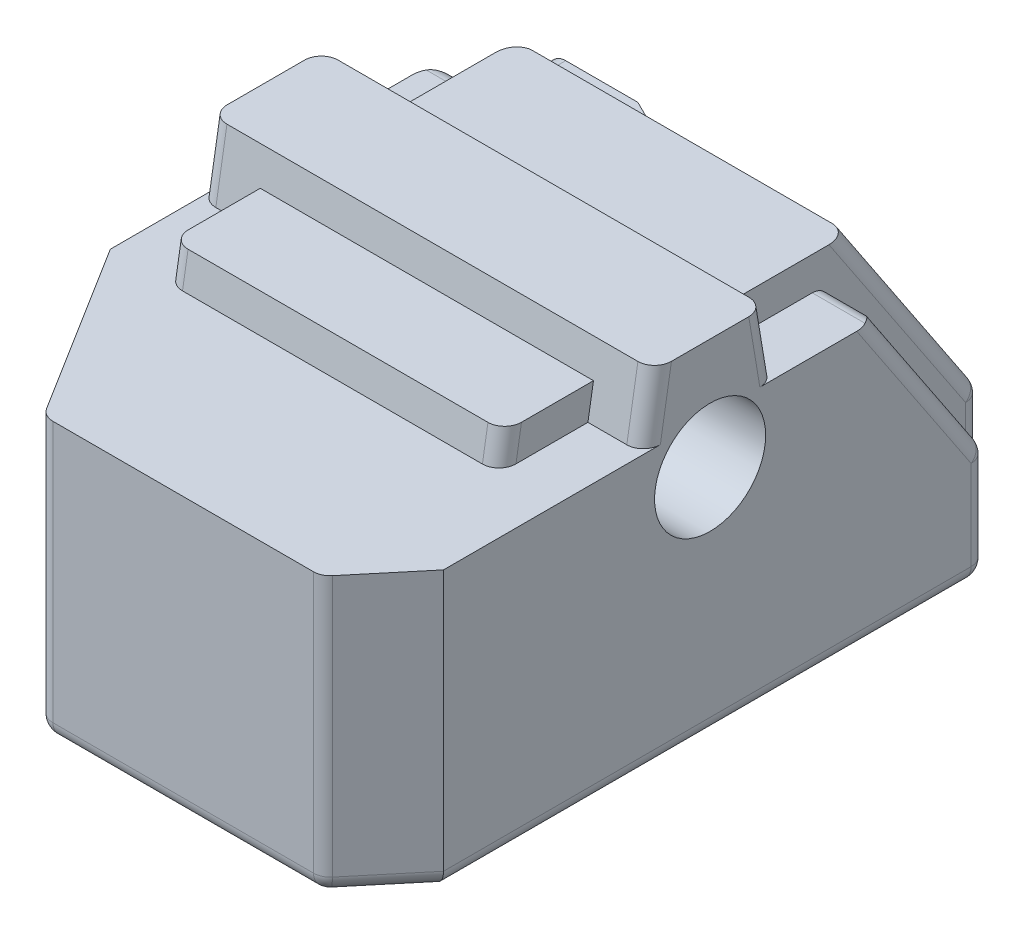
from build123d import *

# Parameters (mm, degrees)
SKETCH1_R           = 5
BOSS_EXTRUDE1_DEPTH = 20
BOSS_EXTRUDE2_DEPTH = 15
CUT_EXTRUDE2_DEPTH  = 49.928519291
BOSS_EXTRUDE3_START = -20
SKETCH4_W           = 20
SKETCH4_H           = 10
BOSS_EXTRUDE3_DEPTH = 20
CUT_EXTRUDE3_DEPTH  = 5
SKETCH2_R           = 10
CUT_EXTRUDE1_DEPTH  = 10
FILLET1_R           = 1.5


with BuildPart() as part:
    # Sketch1 → Boss-Extrude1 (new, symmetric)
    with BuildSketch(Plane(origin=(0, 0, 0), x_dir=(0, 0, -1), z_dir=(1, 0, 0))):
        Polygon((13.5, 12.5), (22.5, 12.5), (32.5, -2.5), (32.5, -12.5), (-22.5, -12.5), (-22.5, 12.5), (1.5, 12.5), (2.5, 18.5), (12.5, 18.5), align=None)
        with Locations((7.5, 8.5)):
            Circle(SKETCH1_R, mode=Mode.SUBTRACT)
    extrude(amount=BOSS_EXTRUDE1_DEPTH, both=True)

    # Sketch1<3> → Boss-Extrude2 (add, symmetric)
    with BuildSketch(Plane(origin=(0, 0, 0), x_dir=(0, 0, -1), z_dir=(1, 0, 0))):
        Polygon((13.5, 12.5), (22.5, 12.5), (32.5, -2.5), (32.5, -11.5), (37, -11.5), (37, -2.5), (25, 15.5), (13, 15.5), align=None)
        Polygon((1.5, 12.5), (2, 15.5), (-6, 15.5), (-6.5, 12.5), align=None)
    extrude(amount=BOSS_EXTRUDE2_DEPTH, both=True)

    # Sketch3 → Cut-Extrude2 (cut, through all)
    with BuildSketch(Plane(origin=(0, 12.5, 0), x_dir=(1, 0, 0), z_dir=(0, 1, 0))):
        Polygon((15, -22.5), (20, -16.5), (20, -22.5), align=None)
        Polygon((-10, -22.5), (-20, -22.5), (-20, -6.5), align=None)
    extrude(amount=-CUT_EXTRUDE2_DEPTH, mode=Mode.SUBTRACT)

    # Sketch4 → Boss-Extrude3 (add)
    with BuildSketch(Plane.XY.offset(BOSS_EXTRUDE3_START)):
        with Locations((-17, -3.8)):
            Rectangle(SKETCH4_W, SKETCH4_H)
    extrude(amount=-BOSS_EXTRUDE3_DEPTH)

    # Sketch5 → Cut-Extrude3 (cut, symmetric)
    with BuildSketch(Plane(origin=(0, -3.8, 0), x_dir=(-1, 0, 0), z_dir=(0, -1, 0))):
        Polygon((7, 40), (19, 40), (7, 34), align=None)
    extrude(amount=CUT_EXTRUDE3_DEPTH, both=True, mode=Mode.SUBTRACT)

    # Sketch2 → Cut-Extrude1 (cut)
    with BuildSketch(Plane.XZ.offset(12.5)):
        with Locations(Location((0, -7.5, 0), (0, 0, 270))):
            Circle(SKETCH2_R)
    extrude(amount=-CUT_EXTRUDE1_DEPTH, mode=Mode.SUBTRACT)

    # Fillet1
    # the kernel refuses this fillet: 1.5 mm, written as the material it takes off along each edge
    with BuildSketch(Plane(origin=(-9.168628538, -11, 21), x_dir=(0, 0, 1), z_dir=(0, -1, 0))) as fillet1_piece_1_section:
        Polygon((0, 0), (FILLET1_R, 0), (FILLET1_R, FILLET1_R * 0.554247641507), (FILLET1_R * 0.529998940003, FILLET1_R * 0.847998304005), align=None)
    fillet1_piece_1 = extrude(amount=FILLET1_R, mode=Mode.PRIVATE)
    fillet1_piece_1 = fillet1_piece_1 - Plane(origin=(-9.168628538, -11, 21), x_dir=(0.4847685323929452, 0, -0.8746424812468178), z_dir=(0, -1, 0)) * Sphere(FILLET1_R, mode=Mode.PRIVATE)
    add(fillet1_piece_1, mode=Mode.SUBTRACT)
    with BuildSketch(Plane(origin=(18.5, -2.954163457, -31), x_dir=(0, 0, -1), z_dir=(1, 0, 0))) as fillet1_piece_2_section:
        Polygon((0, 0), (FILLET1_R, 0), (FILLET1_R, FILLET1_R * 0.302775637732), (FILLET1_R * 0.832050294338, FILLET1_R * 0.554700196225), align=None)
    fillet1_piece_2 = extrude(amount=FILLET1_R, mode=Mode.PRIVATE)
    fillet1_piece_2 = fillet1_piece_2 - Plane(origin=(18.5, -2.954163457, -31), x_dir=(0, -0.2897841486884299, 0.9570920264890529), z_dir=(1, 0, 0)) * Sphere(FILLET1_R, mode=Mode.PRIVATE)
    add(fillet1_piece_2, mode=Mode.SUBTRACT)
    with BuildSketch(Plane(origin=(18.5, -11, -31), x_dir=(1, 0, 0), z_dir=(0, 0, -1))) as fillet1_piece_3_section:
        Polygon((0, 0), (FILLET1_R, 0), (FILLET1_R, FILLET1_R), (0, FILLET1_R), align=None)
    fillet1_piece_3 = extrude(amount=FILLET1_R, mode=Mode.PRIVATE)
    fillet1_piece_3 = fillet1_piece_3 - Plane(origin=(18.5, -11, -31), x_dir=(-0.7071067811865475, 0.7071067811865475, 0), z_dir=(0, 0, -1)) * Sphere(FILLET1_R, mode=Mode.PRIVATE)
    add(fillet1_piece_3, mode=Mode.SUBTRACT)
    with BuildSketch(Plane(origin=(13.5, -2.954163457, -35.5), x_dir=(0, 0.5547001962252297, -0.8320502943378434), z_dir=(1, 0, 0))) as fillet1_piece_4_section:
        Polygon((0, 0), (FILLET1_R, 0), (FILLET1_R, -FILLET1_R * 0.302775637732), (FILLET1_R * 0.832050294338, -FILLET1_R * 0.554700196225), align=None)
    fillet1_piece_4 = extrude(amount=FILLET1_R, mode=Mode.PRIVATE)
    fillet1_piece_4 = fillet1_piece_4 - Plane(origin=(13.5, -2.954163457, -35.5), x_dir=(0, -0.2897841486884304, 0.9570920264890528), z_dir=(1, 0, 0)) * Sphere(FILLET1_R, mode=Mode.PRIVATE)
    add(fillet1_piece_4, mode=Mode.SUBTRACT)
    with BuildSketch(Plane(origin=(14.297437581, -11, 21), x_dir=(0, 0, 1), z_dir=(0, -1, 0))) as fillet1_piece_5_section:
        Polygon((0, 0), (FILLET1_R, 0), (FILLET1_R, -FILLET1_R * 0.468374945984), (FILLET1_R * 0.640184399664, -FILLET1_R * 0.768221279597), align=None)
    fillet1_piece_5 = extrude(amount=FILLET1_R, mode=Mode.PRIVATE)
    fillet1_piece_5 = fillet1_piece_5 - Plane(origin=(14.297437581, -11, 21), x_dir=(-0.42415539624972376, 0, -0.90558942122368), z_dir=(0, -1, 0)) * Sphere(FILLET1_R, mode=Mode.PRIVATE)
    add(fillet1_piece_5, mode=Mode.SUBTRACT)
    with BuildSketch(Plane(origin=(-10, 14.578428656, 22.5), x_dir=(-0.5299989400031788, 0, -0.8479983040050887), z_dir=(0, -1, 0))) as fillet1_piece_6:
        with BuildLine():
            CenterArc((FILLET1_R * 0.554247641507, FILLET1_R), FILLET1_R, 212.005383208, 57.994616792)
            Line((-FILLET1_R * 0.293750662498, FILLET1_R * 0.470001059997), (0, 0))
            Line((0, 0), (FILLET1_R * 0.554247641507, 0))
        make_face()
    extrude(amount=25.578428656, mode=Mode.SUBTRACT)
    with BuildSketch(Plane(origin=(20, -2.954163457, -32.5), x_dir=(0, 0, 1), z_dir=(0, -1, 0))) as fillet1_piece_7:
        with BuildLine():
            CenterArc((FILLET1_R, FILLET1_R), FILLET1_R, 180, 90)
            Line((0, FILLET1_R), (0, 0))
            Line((0, 0), (FILLET1_R, 0))
        make_face()
    extrude(amount=8.045836543, mode=Mode.SUBTRACT)
    with BuildSketch(Plane(origin=(15, -15.25, -37), x_dir=(0, 0, 1), z_dir=(0, 1, 0))) as fillet1_piece_8:
        with BuildLine():
            CenterArc((FILLET1_R, -FILLET1_R), FILLET1_R, 90, 90)
            Line((0, -FILLET1_R), (0, 0))
            Line((0, 0), (FILLET1_R, 0))
        make_face()
    extrude(amount=12.295836543, mode=Mode.SUBTRACT)
    with BuildSketch(Plane(origin=(13.5, -2.5, -37), x_dir=(0, 0.8320502943378404, 0.5547001962252341), z_dir=(-1, 0, 0))) as fillet1_piece_9:
        with BuildLine():
            CenterArc((FILLET1_R * 0.302775637732, -FILLET1_R), FILLET1_R, 90, 33.690067526)
            Line((-FILLET1_R * 0.251924558493, -FILLET1_R * 0.167949705662), (0, 0))
            Line((0, 0), (FILLET1_R * 0.302775637732, 0))
        make_face()
    extrude(amount=21.635408641, mode=Mode.SUBTRACT)
    with BuildSketch(Plane(origin=(-15, -1.920188604, -36.613459069), x_dir=(0, -0.5547001962252296, 0.8320502943378434), z_dir=(0, 0.8320502943378434, 0.5547001962252297))) as fillet1_piece_10_section:
        with BuildLine():
            CenterArc((FILLET1_R, FILLET1_R), FILLET1_R, 180, 90)
            Line((0, FILLET1_R), (0, 0))
            Line((0, 0), (FILLET1_R, 0))
        make_face()
    fillet1_piece_10 = extrude(amount=24.68646108, mode=Mode.PRIVATE)
    fillet1_piece_10 = split(fillet1_piece_10, bisect_by=Plane(origin=(-14.658418679, 1.2, -28.384678204), z_dir=(0, 1, 0)), keep=Keep.TOP, mode=Mode.PRIVATE)
    add(fillet1_piece_10, mode=Mode.SUBTRACT)
    with BuildSketch(Plane(origin=(15, -2.122113162, -36.748075442), x_dir=(0, -0.5547001962252296, 0.8320502943378433), z_dir=(0, 0.8320502943378434, 0.5547001962252297))) as fillet1_piece_11:
        with BuildLine():
            CenterArc((FILLET1_R, -FILLET1_R), FILLET1_R, 90, 90)
            Line((0, -FILLET1_R), (0, 0))
            Line((0, 0), (FILLET1_R, 0))
        make_face()
    extrude(amount=24.929144196, mode=Mode.SUBTRACT)
    with BuildSketch(Plane(origin=(20, 15.620188604, -20.419874264), x_dir=(0, -0.5547001962252294, 0.8320502943378434), z_dir=(0, -0.8320502943378436, -0.5547001962252295))) as fillet1_piece_12:
        with BuildLine():
            CenterArc((FILLET1_R, FILLET1_R), FILLET1_R, 180, 90)
            Line((0, FILLET1_R), (0, 0))
            Line((0, 0), (FILLET1_R, 0))
        make_face()
    extrude(amount=21.323592921, mode=Mode.SUBTRACT)
    with BuildSketch(Plane(origin=(-20, 15.620188604, -20.419874264), x_dir=(1, 0, 0), z_dir=(0, -0.8320502943378436, -0.5547001962252295))) as fillet1_piece_13_section:
        with BuildLine():
            CenterArc((FILLET1_R, FILLET1_R), FILLET1_R, 180, 90)
            Line((0, FILLET1_R), (0, 0))
            Line((0, 0), (FILLET1_R, 0))
        make_face()
    fillet1_piece_13 = extrude(amount=21.080909804, mode=Mode.PRIVATE)
    fillet1_piece_13 = split(fillet1_piece_13, bisect_by=Plane(origin=(-19.657999481, 1.2, -24.885399818), z_dir=(0, 1, 0)), keep=Keep.TOP, mode=Mode.PRIVATE)
    add(fillet1_piece_13, mode=Mode.SUBTRACT)
    with BuildSketch(Plane(origin=(-15, 12.5, -22.5), x_dir=(0, 0, 1), z_dir=(-1, 0, 0)), Plane(origin=(22.006939094, 12.5, -22.5), x_dir=(0, 0, 1), z_dir=(-1, 0, 0))) as fillet1_piece_14:
        with BuildLine():
            CenterArc((FILLET1_R * 0.535183758488, -FILLET1_R), FILLET1_R, 90, 56.309932474)
            Line((-FILLET1_R * 0.29686653585, -FILLET1_R * 0.445299803775), (0, 0))
            Line((0, 0), (FILLET1_R * 0.535183758488, 0))
        make_face()
    extrude(amount=7.006939094, mode=Mode.SUBTRACT)
    with BuildSketch(Plane(origin=(18.5, -2.5, -32.5), x_dir=(0, -1, 0), z_dir=(-1, 0, 0))) as fillet1_piece_15:
        with BuildLine():
            CenterArc((FILLET1_R * 0.302775637732, FILLET1_R), FILLET1_R, 236.309932474, 33.690067526)
            Line((-FILLET1_R * 0.251924558493, FILLET1_R * 0.167949705662), (0, 0))
            Line((0, 0), (FILLET1_R * 0.302775637732, 0))
        make_face()
    extrude(amount=3.5, mode=Mode.SUBTRACT)
    with BuildSketch(Plane(origin=(15, 14.256406047, 22.5), x_dir=(0.6401843996644804, 0, -0.7682212795973754), z_dir=(0, -1, 0))) as fillet1_piece_16:
        with BuildLine():
            CenterArc((FILLET1_R * 0.468374945984, -FILLET1_R), FILLET1_R, 90, 50.194428908)
            Line((-FILLET1_R * 0.299846333613, -FILLET1_R * 0.359815600336), (0, 0))
            Line((0, 0), (FILLET1_R * 0.468374945984, 0))
        make_face()
    extrude(amount=25.256406047, mode=Mode.SUBTRACT)
    with BuildSketch(Plane(origin=(-27, 4.95, -20), x_dir=(1, 0, 0), z_dir=(0, -1, 0))) as fillet1_piece_17:
        with BuildLine():
            CenterArc((FILLET1_R, -FILLET1_R), FILLET1_R, 90, 90)
            Line((0, -FILLET1_R), (0, 0))
            Line((0, 0), (FILLET1_R, 0))
        make_face()
    extrude(amount=17.5, mode=Mode.SUBTRACT)
    with BuildSketch(Plane(origin=(18.5, -12.5, -32.5), x_dir=(0, 0, 1), z_dir=(-1, 0, 0))) as fillet1_piece_18_section:
        with BuildLine():
            CenterArc((FILLET1_R, FILLET1_R), FILLET1_R, 180, 90)
            Line((0, FILLET1_R), (0, 0))
            Line((0, 0), (FILLET1_R, 0))
        make_face()
    fillet1_piece_18 = extrude(amount=42.25, mode=Mode.PRIVATE)
    fillet1_piece_18 = split(fillet1_piece_18, bisect_by=Plane(origin=(15, -12.205839998, -32.142494848), z_dir=(1, 0, 0)), keep=Keep.TOP, mode=Mode.PRIVATE)
    fillet1_piece_18 = split(fillet1_piece_18, bisect_by=Plane(origin=(16.75, -11.5, -32.142494848), z_dir=(0, -1, 0)), keep=Keep.TOP, mode=Mode.PRIVATE)
    add(fillet1_piece_18, mode=Mode.SUBTRACT)
    with BuildSketch(Plane(origin=(18.5, -12.5, -32.5), x_dir=(0, 0, 1), z_dir=(-1, 0, 0))) as fillet1_piece_19_section:
        with BuildLine():
            CenterArc((FILLET1_R, FILLET1_R), FILLET1_R, 180, 90)
            Line((0, FILLET1_R), (0, 0))
            Line((0, 0), (FILLET1_R, 0))
        make_face()
    fillet1_piece_19 = extrude(amount=42.25, mode=Mode.PRIVATE)
    fillet1_piece_19 = split(fillet1_piece_19, bisect_by=Plane(origin=(15, -11.310985745, -32.495303959), z_dir=(1, 0, 0)), keep=Keep.TOP, mode=Mode.PRIVATE)
    fillet1_piece_19 = split(fillet1_piece_19, bisect_by=Plane(origin=(16.75, -11.5, -32.495303959), z_dir=(0, 1, 0)), keep=Keep.TOP, mode=Mode.PRIVATE)
    add(fillet1_piece_19, mode=Mode.SUBTRACT)
    with BuildSketch(Plane(origin=(18.5, -12.5, -32.5), x_dir=(0, 0, 1), z_dir=(-1, 0, 0))) as fillet1_piece_20_section:
        with BuildLine():
            CenterArc((FILLET1_R, FILLET1_R), FILLET1_R, 180, 90)
            Line((0, FILLET1_R), (0, 0))
            Line((0, 0), (FILLET1_R, 0))
        make_face()
    fillet1_piece_20 = extrude(amount=42.25, mode=Mode.PRIVATE)
    fillet1_piece_20 = split(fillet1_piece_20, bisect_by=Plane(origin=(15, -12.205839998, -32.142494848), z_dir=(-1, 0, 0)), keep=Keep.TOP, mode=Mode.PRIVATE)
    fillet1_piece_20 = split(fillet1_piece_20, bisect_by=Plane(origin=(-15, -12.205839998, -32.142494848), z_dir=(1, 0, 0)), keep=Keep.TOP, mode=Mode.PRIVATE)
    fillet1_piece_20 = split(fillet1_piece_20, bisect_by=Plane(origin=(0, -11.5, -32.142494848), z_dir=(0, -1, 0)), keep=Keep.TOP, mode=Mode.PRIVATE)
    add(fillet1_piece_20, mode=Mode.SUBTRACT)
    with BuildSketch(Plane(origin=(18.5, -12.5, -32.5), x_dir=(0, 0, 1), z_dir=(-1, 0, 0))) as fillet1_piece_21_section:
        with BuildLine():
            CenterArc((FILLET1_R, FILLET1_R), FILLET1_R, 180, 90)
            Line((0, FILLET1_R), (0, 0))
            Line((0, 0), (FILLET1_R, 0))
        make_face()
    fillet1_piece_21 = extrude(amount=42.25, mode=Mode.PRIVATE)
    fillet1_piece_21 = split(fillet1_piece_21, bisect_by=Plane(origin=(-15, -12.205839998, -32.142494848), z_dir=(-1, 0, 0)), keep=Keep.TOP, mode=Mode.PRIVATE)
    fillet1_piece_21 = split(fillet1_piece_21, bisect_by=Plane(origin=(-19.375, -11.5, -32.142494848), z_dir=(0, -1, 0)), keep=Keep.TOP, mode=Mode.PRIVATE)
    add(fillet1_piece_21, mode=Mode.SUBTRACT)
    with BuildSketch(Plane(origin=(18.5, -12.5, -32.5), x_dir=(0, 0, 1), z_dir=(-1, 0, 0))) as fillet1_piece_22_section:
        with BuildLine():
            CenterArc((FILLET1_R, FILLET1_R), FILLET1_R, 180, 90)
            Line((0, FILLET1_R), (0, 0))
            Line((0, 0), (FILLET1_R, 0))
        make_face()
    fillet1_piece_22 = extrude(amount=42.25, mode=Mode.PRIVATE)
    fillet1_piece_22 = split(fillet1_piece_22, bisect_by=Plane(origin=(-15, -11.310985745, -32.495303959), z_dir=(-1, 0, 0)), keep=Keep.TOP, mode=Mode.PRIVATE)
    fillet1_piece_22 = split(fillet1_piece_22, bisect_by=Plane(origin=(-19.375, -11.5, -32.495303959), z_dir=(0, 1, 0)), keep=Keep.TOP, mode=Mode.PRIVATE)
    add(fillet1_piece_22, mode=Mode.SUBTRACT)
    with BuildSketch(Plane(origin=(-20, -12.5, -36.25), x_dir=(0, 1, 0), z_dir=(0, 0, 1))) as fillet1_piece_23:
        with BuildLine():
            CenterArc((FILLET1_R, -FILLET1_R), FILLET1_R, 90, 90)
            Line((0, -FILLET1_R), (0, 0))
            Line((0, 0), (FILLET1_R, 0))
        make_face()
    extrude(amount=46.5, mode=Mode.SUBTRACT)
    with BuildSketch(Plane(origin=(-21.987496025, -12.5, 3.32000636), x_dir=(0, 1, 0), z_dir=(0.52999894000318, 0, 0.847998304005088))) as fillet1_piece_24:
        with BuildLine():
            CenterArc((FILLET1_R, -FILLET1_R), FILLET1_R, 90, 90)
            Line((0, -FILLET1_R), (0, 0))
            Line((0, 0), (FILLET1_R, 0))
        make_face()
    extrude(amount=21.786590802, mode=Mode.SUBTRACT)
    with BuildSketch(Plane(origin=(14.297437581, -12.5, 22.5), x_dir=(0, 0, -1), z_dir=(-1, 0, 0))) as fillet1_piece_25:
        with BuildLine():
            CenterArc((FILLET1_R, -FILLET1_R), FILLET1_R, 90, 90)
            Line((0, -FILLET1_R), (0, 0))
            Line((0, 0), (FILLET1_R, 0))
        make_face()
    extrude(amount=23.466066119, mode=Mode.SUBTRACT)
    with BuildSketch(Plane(origin=(15.4497695, -12.5, 21.960276599), x_dir=(-0.7682212795973761, 0, -0.6401843996644797), z_dir=(0.6401843996644797, 0, -0.7682212795973761))) as fillet1_piece_26:
        with BuildLine():
            CenterArc((FILLET1_R, FILLET1_R), FILLET1_R, 180, 90)
            Line((0, FILLET1_R), (0, 0))
            Line((0, 0), (FILLET1_R, 0))
        make_face()
    extrude(amount=10.857687257, mode=Mode.SUBTRACT)
    with BuildSketch(Plane(origin=(20, -12.5, -31), x_dir=(0, 1, 0), z_dir=(0, 0, 1))) as fillet1_piece_27:
        with BuildLine():
            CenterArc((FILLET1_R, FILLET1_R), FILLET1_R, 180, 90)
            Line((0, FILLET1_R), (0, 0))
            Line((0, 0), (FILLET1_R, 0))
        make_face()
    extrude(amount=51.25, mode=Mode.SUBTRACT)
    with BuildSketch(Plane(origin=(-15, 19.198977214, 5.383503798), x_dir=(0, -0.16439898730535804, -0.9863939238321436), z_dir=(0, -0.9863939238321436, 0.16439898730535804))) as fillet1_piece_28_section:
        with BuildLine():
            CenterArc((FILLET1_R, FILLET1_R), FILLET1_R, 180, 90)
            Line((0, FILLET1_R), (0, 0))
            Line((0, 0), (FILLET1_R, 0))
        make_face()
    fillet1_piece_28 = extrude(amount=10.541381265, mode=Mode.PRIVATE)
    fillet1_piece_28 = split(fillet1_piece_28, bisect_by=Plane(origin=(-14.658878509, 12.5, 5.604715473), z_dir=(0, 1, 0)), keep=Keep.TOP, mode=Mode.PRIVATE)
    add(fillet1_piece_28, mode=Mode.SUBTRACT)
    with BuildSketch(Plane(origin=(15, 19.198977214, 5.383503798), x_dir=(0, -0.16439898730535804, -0.9863939238321436), z_dir=(0, -0.9863939238321436, 0.16439898730535804))) as fillet1_piece_29_section:
        with BuildLine():
            CenterArc((FILLET1_R, -FILLET1_R), FILLET1_R, 90, 90)
            Line((0, -FILLET1_R), (0, 0))
            Line((0, 0), (FILLET1_R, 0))
        make_face()
    fillet1_piece_29 = extrude(amount=10.541381265, mode=Mode.PRIVATE)
    fillet1_piece_29 = split(fillet1_piece_29, bisect_by=Plane(origin=(14.658878509, 12.5, 5.604715473), z_dir=(0, 1, 0)), keep=Keep.TOP, mode=Mode.PRIVATE)
    add(fillet1_piece_29, mode=Mode.SUBTRACT)
    with BuildSketch(Plane(origin=(-20, 22.198977214, -11.883503798), x_dir=(1, 0, 0), z_dir=(0, -0.9863939238321437, -0.1643989873053573))) as fillet1_piece_30_section:
        with BuildLine():
            CenterArc((FILLET1_R, FILLET1_R), FILLET1_R, 180, 90)
            Line((0, FILLET1_R), (0, 0))
            Line((0, 0), (FILLET1_R, 0))
        make_face()
    fillet1_piece_30 = extrude(amount=13.58276253, mode=Mode.PRIVATE)
    fillet1_piece_30 = split(fillet1_piece_30, bisect_by=Plane(origin=(-19.659354127, 12.5, -12.353910306), z_dir=(0, 1, 0)), keep=Keep.TOP, mode=Mode.PRIVATE)
    add(fillet1_piece_30, mode=Mode.SUBTRACT)
    with BuildSketch(Plane(origin=(-20, 8.801022786, -0.883503798), x_dir=(0, -0.16439898730535737, -0.9863939238321437), z_dir=(0, 0.9863939238321437, -0.16439898730535735))) as fillet1_piece_31_section:
        with BuildLine():
            CenterArc((FILLET1_R, -FILLET1_R), FILLET1_R, 90, 90)
            Line((0, -FILLET1_R), (0, 0))
            Line((0, 0), (FILLET1_R, 0))
        make_face()
    fillet1_piece_31 = extrude(amount=13.58276253, mode=Mode.PRIVATE)
    fillet1_piece_31 = split(fillet1_piece_31, bisect_by=Plane(origin=(-19.659354127, 12.5, -2.646089694), z_dir=(0, 1, 0)), keep=Keep.TOP, mode=Mode.PRIVATE)
    add(fillet1_piece_31, mode=Mode.SUBTRACT)
    with BuildSketch(Plane(origin=(20, 8.801022786, -0.883503798), x_dir=(0, -0.16439898730535737, -0.9863939238321437), z_dir=(0, 0.9863939238321437, -0.16439898730535735))) as fillet1_piece_32_section:
        with BuildLine():
            CenterArc((FILLET1_R, FILLET1_R), FILLET1_R, 180, 90)
            Line((0, FILLET1_R), (0, 0))
            Line((0, 0), (FILLET1_R, 0))
        make_face()
    fillet1_piece_32 = extrude(amount=13.58276253, mode=Mode.PRIVATE)
    fillet1_piece_32 = split(fillet1_piece_32, bisect_by=Plane(origin=(19.659354127, 12.5, -2.646089694), z_dir=(0, 1, 0)), keep=Keep.TOP, mode=Mode.PRIVATE)
    add(fillet1_piece_32, mode=Mode.SUBTRACT)
    with BuildSketch(Plane(origin=(20, 22.198977214, -11.883503798), x_dir=(-1, 0, 0), z_dir=(0, -0.9863939238321437, -0.1643989873053573))) as fillet1_piece_33_section:
        with BuildLine():
            CenterArc((FILLET1_R, -FILLET1_R), FILLET1_R, 90, 90)
            Line((0, -FILLET1_R), (0, 0))
            Line((0, 0), (FILLET1_R, 0))
        make_face()
    fillet1_piece_33 = extrude(amount=13.58276253, mode=Mode.PRIVATE)
    fillet1_piece_33 = split(fillet1_piece_33, bisect_by=Plane(origin=(19.659354127, 12.5, -12.353910306), z_dir=(0, 1, 0)), keep=Keep.TOP, mode=Mode.PRIVATE)
    add(fillet1_piece_33, mode=Mode.SUBTRACT)
    with BuildSketch(Plane(origin=(-18.75, -11.5, -37), x_dir=(0, 0, 1), z_dir=(1, 0, 0))) as fillet1_piece_34:
        with BuildLine():
            CenterArc((FILLET1_R, -FILLET1_R), FILLET1_R, 90, 90)
            Line((0, -FILLET1_R), (0, 0))
            Line((0, 0), (FILLET1_R, 0))
        make_face()
    extrude(amount=37.5, mode=Mode.SUBTRACT)
    with BuildSketch(Plane(origin=(-27, -8.8, -16.25), x_dir=(1, 0, 0), z_dir=(0, 0, -1))) as fillet1_piece_35:
        with BuildLine():
            CenterArc((FILLET1_R, -FILLET1_R), FILLET1_R, 90, 90)
            Line((0, -FILLET1_R), (0, 0))
            Line((0, 0), (FILLET1_R, 0))
        make_face()
    extrude(amount=27.5, mode=Mode.SUBTRACT)
    with BuildSketch(Plane(origin=(-27, 1.2, -16.25), x_dir=(1, 0, 0), z_dir=(0, 0, -1))) as fillet1_piece_36:
        with BuildLine():
            CenterArc((FILLET1_R, FILLET1_R), FILLET1_R, 180, 90)
            Line((0, FILLET1_R), (0, 0))
            Line((0, 0), (FILLET1_R, 0))
        make_face()
    extrude(amount=27.5, mode=Mode.SUBTRACT)


solid = part.part
